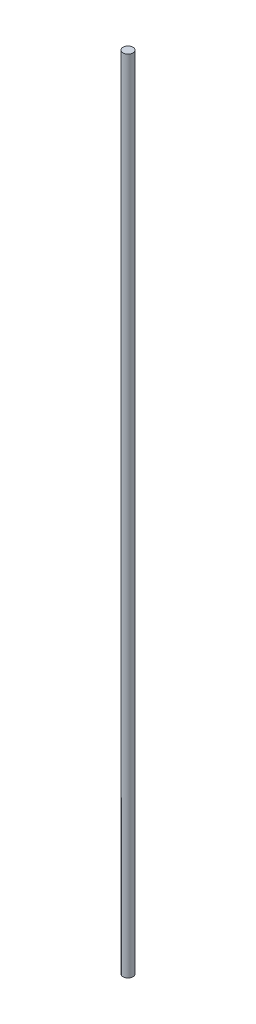
from build123d import *

# Parameters (mm, degrees)
SKETCH1_R           = 5.08
BOSS_EXTRUDE1_DEPTH = 820.42


with BuildPart() as part:
    # Sketch1 → Boss-Extrude1 (new body)
    with BuildSketch(Plane(origin=(0, 0, 0), x_dir=(1, 0, 0), z_dir=(0, 1, 0))):
        Circle(SKETCH1_R)
    extrude(amount=BOSS_EXTRUDE1_DEPTH)


solid = part.part
